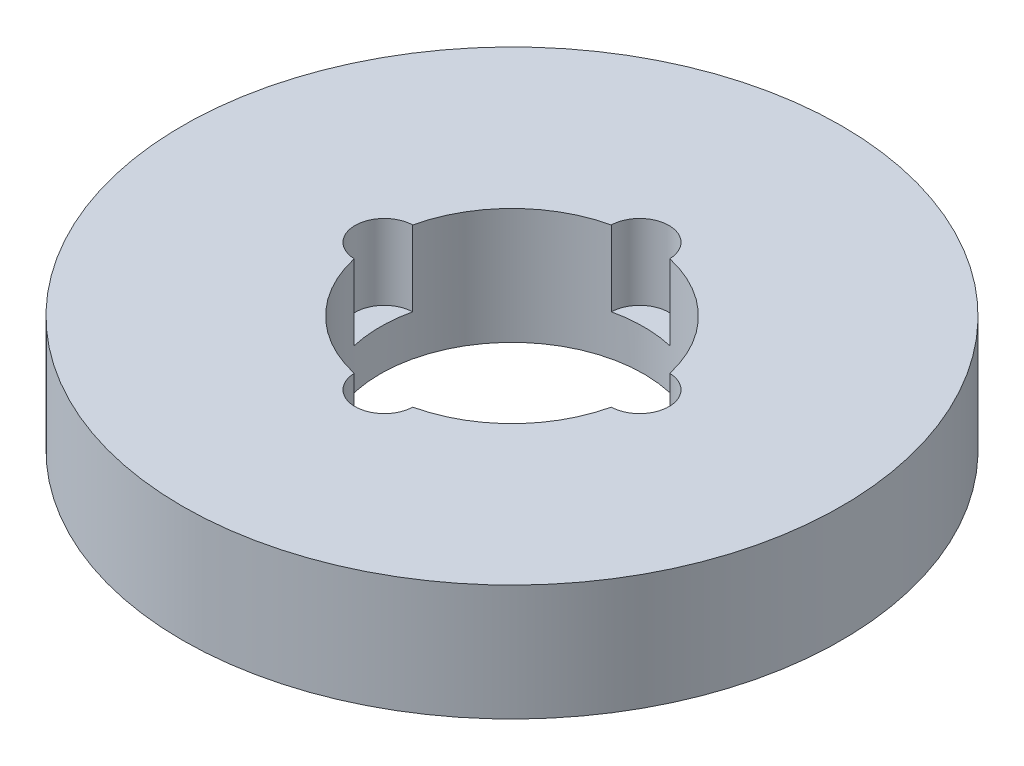
from build123d import *

# Parameters (mm, degrees)
SKETCH1_R           = 62.5
BOSS_EXTRUDE1_DEPTH = 22
SKETCH2_R           = 25
CUT_EXTRUDE1_DEPTH  = 92.08512502
SKETCH3_R           = 5.550313727
CUT_EXTRUDE2_DEPTH  = 14.274636139
CIRPATTERN1_COUNT   = 4


with BuildPart() as part:
    # Sketch1 → Boss-Extrude1 (new body)
    with BuildSketch(Plane(origin=(0, 0, 0), x_dir=(1, 0, 0), z_dir=(0, 1, 0))):
        Circle(SKETCH1_R)
    extrude(amount=BOSS_EXTRUDE1_DEPTH)

    # Sketch2 → Cut-Extrude1 (cut, through all)
    with BuildSketch(Plane(origin=(0, 0, 0), x_dir=(1, 0, 0), z_dir=(0, 1, 0))):
        Circle(SKETCH2_R)
    extrude(amount=CUT_EXTRUDE1_DEPTH, mode=Mode.SUBTRACT)

    # Sketch3 → Cut-Extrude2 (cut)
    with BuildSketch(Plane(origin=(0, 22, 0), x_dir=(1, 0, 0), z_dir=(0, 1, 0))):
        with Locations((-24.211855671, 0)):
            Circle(SKETCH3_R)
    cut_extrude2 = extrude(amount=-CUT_EXTRUDE2_DEPTH, mode=Mode.SUBTRACT)

    # CirPattern1: Cut-Extrude2 ×4 about axis
    cirpattern1_axis = Axis((0, 0, 0), (0, 1, 0))
    for i in range(1, CIRPATTERN1_COUNT):
        add(cut_extrude2.rotate(cirpattern1_axis, i * 360 / CIRPATTERN1_COUNT), mode=Mode.SUBTRACT)


solid = part.part
